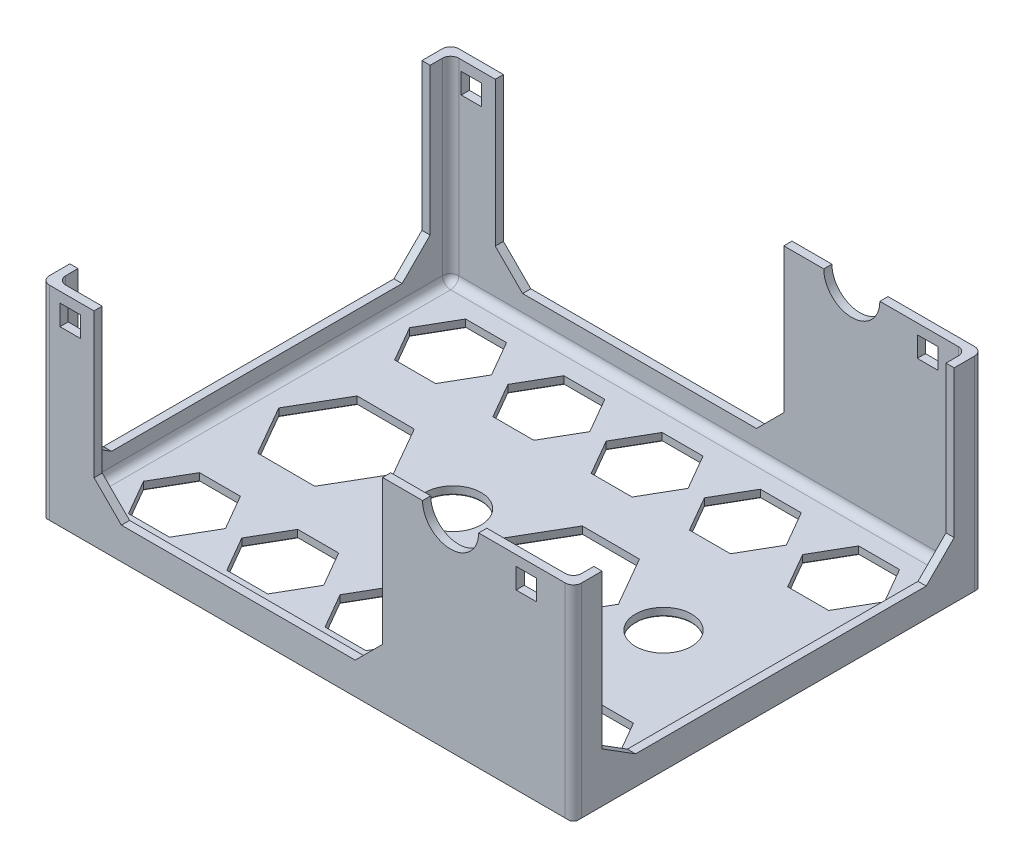
from build123d import *

# Parameters (mm, degrees)
SKETCH1_W            = 130
SKETCH1_H            = 100
BOSS_EXTRUDE1_DEPTH  = 50
SHELL1_T             = -2
CHAMFER1_SIZE        = 0.25
SKETCH2_R            = 6.85
CUT_EXTRUDE1_DEPTH   = 130.325171564
SKETCH3_R            = 6.85
CUT_EXTRUDE2_DEPTH   = 96.021050299
CUT_EXTRUDE3_DEPTH   = 96.021050299
LPATTERN1_COUNT      = 5
LPATTERN1_PITCH      = 24
LPATTERN1_COUNT_DIR2 = 2
LPATTERN1_PITCH_DIR2 = 65
CUT_EXTRUDE4_DEPTH   = 60
LPATTERN2_COUNT      = 2
LPATTERN2_PITCH      = 55
CUT_EXTRUDE7_DEPTH   = 130.325171564
CUT_EXTRUDE8_DEPTH   = 148.986485869
FILLET1_R            = 2
CHAMFER2_SIZE        = 0.25
FILLET2_R            = 0.25
SKETCH10_W           = 5
SKETCH10_H           = 5
CUT_EXTRUDE9_DEPTH   = 130.325171564
SKETCH11_W           = 5
SKETCH11_H           = 5
CUT_EXTRUDE10_DEPTH  = 130.325171564


with BuildPart() as part:
    # Sketch1 → Boss-Extrude1 (new body)
    with BuildSketch(Plane(origin=(0, 0, 0), x_dir=(1, 0, 0), z_dir=(0, 1, 0))):
        Rectangle(SKETCH1_W, SKETCH1_H)
    extrude(amount=BOSS_EXTRUDE1_DEPTH)

    # Shell1
    shell1_openings = [part.faces().sort_by_distance(p)[0] for p in [
        (0, 50, 0),
    ]]
    offset(amount=SHELL1_T, openings=shell1_openings, kind=Kind.INTERSECTION)

    # Chamfer1
    chamfer1_edges = [part.edges().sort_by_distance(p)[0] for p in [
        (0, 0, 50),
        (-65, 0, 0),
        (0, 0, -50),
        (65, 0, 0),
    ]]
    chamfer(chamfer1_edges, length=CHAMFER1_SIZE)

    # Sketch2 → Cut-Extrude1 (cut, through all)
    with BuildSketch(Plane.XY.offset(50)):
        with Locations((35, 50)):
            Circle(SKETCH2_R)
    extrude(amount=-CUT_EXTRUDE1_DEPTH, mode=Mode.SUBTRACT)

    # Sketch3 → Cut-Extrude2 (cut, through all)
    with BuildSketch(Plane(origin=(0, 2, 0), x_dir=(1, 0, 0), z_dir=(0, 1, 0))):
        with Locations(Location((-14.4, 0, 0), (0, 0, 270))):
            Circle(SKETCH3_R)
        with Locations(Location((37, 0, 0), (0, 0, 270))):
            Circle(SKETCH3_R)
    extrude(amount=-CUT_EXTRUDE2_DEPTH, mode=Mode.SUBTRACT)

    # Sketch4 → Cut-Extrude3 (cut, through all)
    with BuildSketch(Plane(origin=(0, 2, 0), x_dir=(1, 0, 0), z_dir=(0, 1, 0))):
        Polygon((-38, 33), (-43, 41.660254038), (-53, 41.660254038), (-58, 33), (-53, 24.339745962), (-43, 24.339745962), align=None)
    cut_extrude3 = extrude(amount=-CUT_EXTRUDE3_DEPTH, mode=Mode.SUBTRACT)

    # LPattern1: Cut-Extrude3 5 × 2
    with Locations(*[(i * LPATTERN1_PITCH, 0, j * LPATTERN1_PITCH_DIR2) for i in range(LPATTERN1_COUNT) for j in range(LPATTERN1_COUNT_DIR2) if (i, j) != (0, 0)]):
        add(cut_extrude3, mode=Mode.SUBTRACT)

    # Sketch5 → Cut-Extrude4 (cut)
    with BuildSketch(Plane(origin=(0, 2, 0), x_dir=(1, 0, 0), z_dir=(0, 1, 0))):
        Polygon((-35.975946743, 12.11043665), (-49.975919161, 12.138226883), (-56.999972418, 0.027790233), (-50.024053257, -12.11043665), (-36.024080839, -12.138226883), (-29.000027582, -0.027790233), align=None)
    cut_extrude4 = extrude(amount=-CUT_EXTRUDE4_DEPTH, mode=Mode.SUBTRACT)

    # LPattern2: Cut-Extrude4 ×2
    with Locations(*[(i * LPATTERN2_PITCH, 0, 0) for i in range(1, LPATTERN2_COUNT)]):
        add(cut_extrude4, mode=Mode.SUBTRACT)

    # Sketch8 → Cut-Extrude7 (cut, through all)
    with BuildSketch(Plane(origin=(0, 0, -50), x_dir=(-1, 0, 0), z_dir=(0, 0, -1))):
        Polygon((-18.384474303, 50), (-18.384474303, 14.701645492), (-11.699879712, 8.017050901), (45.40587675, 8.017050901), (52.090471341, 14.701645492), (52.090471341, 50), align=None)
    extrude(amount=-CUT_EXTRUDE7_DEPTH, mode=Mode.SUBTRACT)

    # Sketch9 → Cut-Extrude8 (cut, through all)
    with BuildSketch(Plane.ZY.offset(65)):
        Polygon((-43, 50), (-43, 14.081769411), (-36.168230589, 7.25), (34.814321172, 7.25), (43, 12.382329754), (43, 50), align=None)
    extrude(amount=-CUT_EXTRUDE8_DEPTH, mode=Mode.SUBTRACT)

    # Fillet1
    # the kernel refuses this fillet: 2 mm, written as the material it adds along each edge
    with BuildSketch(Plane(origin=(61, 4, -46), x_dir=(0, 0, -1), z_dir=(1, 0, 0))) as fillet1_piece_1_section:
        Polygon((0, 0), (FILLET1_R, 0), (FILLET1_R, -FILLET1_R), (0, -FILLET1_R), align=None)
    fillet1_piece_1 = extrude(amount=FILLET1_R, mode=Mode.PRIVATE)
    fillet1_piece_1 = fillet1_piece_1 - Plane(origin=(61, 4, -46), x_dir=(0, 0.7071067811865475, 0.7071067811865475), z_dir=(1, 0, 0)) * Sphere(FILLET1_R, mode=Mode.PRIVATE)
    add(fillet1_piece_1)
    with BuildSketch(Plane(origin=(-61, 4, -46), x_dir=(0, 0, -1), z_dir=(-1, 0, 0))) as fillet1_piece_2_section:
        Polygon((0, 0), (FILLET1_R, 0), (FILLET1_R, FILLET1_R), (0, FILLET1_R), align=None)
    fillet1_piece_2 = extrude(amount=FILLET1_R, mode=Mode.PRIVATE)
    fillet1_piece_2 = fillet1_piece_2 - Plane(origin=(-61, 4, -46), x_dir=(0, 0.7071067811865475, 0.7071067811865475), z_dir=(-1, 0, 0)) * Sphere(FILLET1_R, mode=Mode.PRIVATE)
    add(fillet1_piece_2)
    with BuildSketch(Plane(origin=(-61, 4, 46), x_dir=(0, -1, 0), z_dir=(-1, 0, 0))) as fillet1_piece_3_section:
        Polygon((0, 0), (FILLET1_R, 0), (FILLET1_R, FILLET1_R), (0, FILLET1_R), align=None)
    fillet1_piece_3 = extrude(amount=FILLET1_R, mode=Mode.PRIVATE)
    fillet1_piece_3 = fillet1_piece_3 - Plane(origin=(-61, 4, 46), x_dir=(0, 0.7071067811865475, -0.7071067811865475), z_dir=(-1, 0, 0)) * Sphere(FILLET1_R, mode=Mode.PRIVATE)
    add(fillet1_piece_3)
    with BuildSketch(Plane(origin=(61, 4, 46), x_dir=(0, -1, 0), z_dir=(1, 0, 0))) as fillet1_piece_4_section:
        Polygon((0, 0), (FILLET1_R, 0), (FILLET1_R, -FILLET1_R), (0, -FILLET1_R), align=None)
    fillet1_piece_4 = extrude(amount=FILLET1_R, mode=Mode.PRIVATE)
    fillet1_piece_4 = fillet1_piece_4 - Plane(origin=(61, 4, 46), x_dir=(0, 0.7071067811865475, -0.7071067811865475), z_dir=(1, 0, 0)) * Sphere(FILLET1_R, mode=Mode.PRIVATE)
    add(fillet1_piece_4)
    with BuildSketch(Plane(origin=(61, 2, -48), x_dir=(0, 1, 0), z_dir=(-1, 0, 0)), Plane(origin=(-61, 2, 48), x_dir=(0, 1, 0), z_dir=(1, 0, 0))) as fillet1_piece_5:
        with BuildLine():
            CenterArc((FILLET1_R, -FILLET1_R), FILLET1_R, 90, 90)
            Line((0, -FILLET1_R), (0, 0))
            Line((0, 0), (FILLET1_R, 0))
        make_face()
    extrude(amount=122)
    with BuildSketch(Plane(origin=(-63, 2, -46), x_dir=(0, 1, 0), z_dir=(0, 0, 1)), Plane(origin=(63, 2, 46), x_dir=(0, 1, 0), z_dir=(0, 0, -1))) as fillet1_piece_6:
        with BuildLine():
            CenterArc((FILLET1_R, -FILLET1_R), FILLET1_R, 90, 90)
            Line((0, -FILLET1_R), (0, 0))
            Line((0, 0), (FILLET1_R, 0))
        make_face()
    extrude(amount=92)
    with BuildSketch(Plane(origin=(63, 4, 48), x_dir=(-1, 0, 0), z_dir=(0, 1, 0)), Plane(origin=(63, 4, -48), x_dir=(0, 0, 1), z_dir=(0, 1, 0)), Plane(origin=(-63, 50, 48), x_dir=(1, 0, 0), z_dir=(0, -1, 0))) as fillet1_piece_7:
        with BuildLine():
            CenterArc((FILLET1_R, -FILLET1_R), FILLET1_R, 90, 90)
            Line((0, -FILLET1_R), (0, 0))
            Line((0, 0), (FILLET1_R, 0))
        make_face()
    extrude(amount=46)
    with BuildSketch(Plane(origin=(-63, 4, -48), x_dir=(0, 0, 1), z_dir=(0, 1, 0))) as fillet1_piece_8:
        with BuildLine():
            CenterArc((FILLET1_R, FILLET1_R), FILLET1_R, 180, 90)
            Line((0, FILLET1_R), (0, 0))
            Line((0, 0), (FILLET1_R, 0))
        make_face()
    extrude(amount=46)
    # the kernel refuses this fillet: 2 mm, written as the material it takes off along each edge
    with BuildSketch(Plane(origin=(-65, -4.75, -50), x_dir=(0, 0, 1), z_dir=(0, 1, 0)), Plane(origin=(-65, -4.75, 50), x_dir=(1, 0, 0), z_dir=(0, 1, 0))) as fillet1_2_piece_1:
        with BuildLine():
            CenterArc((FILLET1_R, FILLET1_R), FILLET1_R, 180, 90)
            Line((0, FILLET1_R), (0, 0))
            Line((0, 0), (FILLET1_R, 0))
        make_face()
    extrude(amount=59.75, mode=Mode.SUBTRACT)
    with BuildSketch(Plane(origin=(65, -4.75, -50), x_dir=(0, 0, 1), z_dir=(0, 1, 0)), Plane(origin=(65, -4.75, 50), x_dir=(-1, 0, 0), z_dir=(0, 1, 0))) as fillet1_2_piece_2:
        with BuildLine():
            CenterArc((FILLET1_R, -FILLET1_R), FILLET1_R, 90, 90)
            Line((0, -FILLET1_R), (0, 0))
            Line((0, 0), (FILLET1_R, 0))
        make_face()
    extrude(amount=59.75, mode=Mode.SUBTRACT)

    # Chamfer2
    chamfer2_edges = [part.edges().sort_by_distance(p)[0] for p in [
        (7.5, 0, -28.669872981),
        (7.5, 0, -37.330127019),
        (0, 0, -41.660254038),
        (-7.5, 0, -37.330127019),
        (-7.5, 0, -28.669872981),
        (0, 0, -24.339745962),
        (31.5, 0, -28.669872981),
        (31.5, 0, -37.330127019),
        (24, 0, -41.660254038),
        (16.5, 0, -37.330127019),
        (16.5, 0, -28.669872981),
        (24, 0, -24.339745962),
        (55.5, 0, -28.669872981),
        (55.5, 0, -37.330127019),
        (48, 0, -41.660254038),
        (40.5, 0, -37.330127019),
        (40.5, 0, -28.669872981),
        (48, 0, -24.339745962),
        (-40.5, 0, 36.330127019),
        (-40.5, 0, 27.669872981),
        (-48, 0, 23.339745962),
        (-55.5, 0, 27.669872981),
        (-55.5, 0, 36.330127019),
        (-48, 0, 40.660254038),
        (-16.5, 0, 36.330127019),
        (-16.5, 0, 27.669872981),
        (-24, 0, 23.339745962),
        (-31.5, 0, 27.669872981),
        (-31.5, 0, 36.330127019),
        (-24, 0, 40.660254038),
        (7.5, 0, 36.330127019),
        (7.5, 0, 27.669872981),
        (0, 0, 23.339745962),
        (-7.5, 0, 27.669872981),
        (-7.5, 0, 36.330127019),
        (0, 0, 40.660254038),
        (31.5, 0, 36.330127019),
        (31.5, 0, 27.669872981),
        (24, 0, 23.339745962),
        (16.5, 0, 27.669872981),
        (16.5, 0, 36.330127019),
        (24, 0, 40.660254038),
        (55.5, 0, 36.330127019),
        (55.5, 0, 27.669872981),
        (48, 0, 23.339745962),
        (40.5, 0, 27.669872981),
        (40.5, 0, 36.330127019),
        (48, 0, 40.660254038),
        (-32.487987163, 0, -6.041323208),
        (-32.51205421, 0, 6.083008558),
        (-43.024067048, 0, 12.124331766),
        (-53.512012837, 0, 6.041323208),
        (-53.48794579, 0, -6.083008558),
        (-42.975932952, 0, -12.124331766),
        (22.512012837, 0, -6.041323208),
        (22.48794579, 0, 6.083008558),
        (11.975932952, 0, 12.124331766),
        (1.487987163, 0, 6.041323208),
        (1.51205421, 0, -6.083008558),
        (12.024067048, 0, -12.124331766),
        (-40.5, 0, -28.669872981),
        (-48, 0, -24.339745962),
        (-55.5, 0, -28.669872981),
        (-55.5, 0, -37.330127019),
        (-48, 0, -41.660254038),
        (-40.5, 0, -37.330127019),
        (-16.5, 0, -28.669872981),
        (-24, 0, -24.339745962),
        (-31.5, 0, -28.669872981),
        (-31.5, 0, -37.330127019),
        (-24, 0, -41.660254038),
        (-16.5, 0, -37.330127019),
    ]]
    chamfer(chamfer2_edges, length=CHAMFER2_SIZE)

    # Fillet2
    fillet2_edges = [part.edges().sort_by_distance(p)[0] for p in [
        (-14.4, 0, -6.85),
        (37, 0, -6.85),
    ]]
    fillet(fillet2_edges, radius=FILLET2_R)

    # Sketch10 → Cut-Extrude9 (cut, through all)
    with BuildSketch(Plane(origin=(0, 0, -50), x_dir=(-1, 0, 0), z_dir=(0, 0, -1))):
        with Locations((-53.5, 45)):
            Rectangle(SKETCH10_W, SKETCH10_H)
    extrude(amount=-CUT_EXTRUDE9_DEPTH, mode=Mode.SUBTRACT)

    # Sketch11 → Cut-Extrude10 (cut, through all)
    with BuildSketch(Plane(origin=(0, 0, -50), x_dir=(-1, 0, 0), z_dir=(0, 0, -1))):
        with Locations((57.9, 45)):
            Rectangle(SKETCH11_W, SKETCH11_H)
    extrude(amount=-CUT_EXTRUDE10_DEPTH, mode=Mode.SUBTRACT)


solid = part.part
